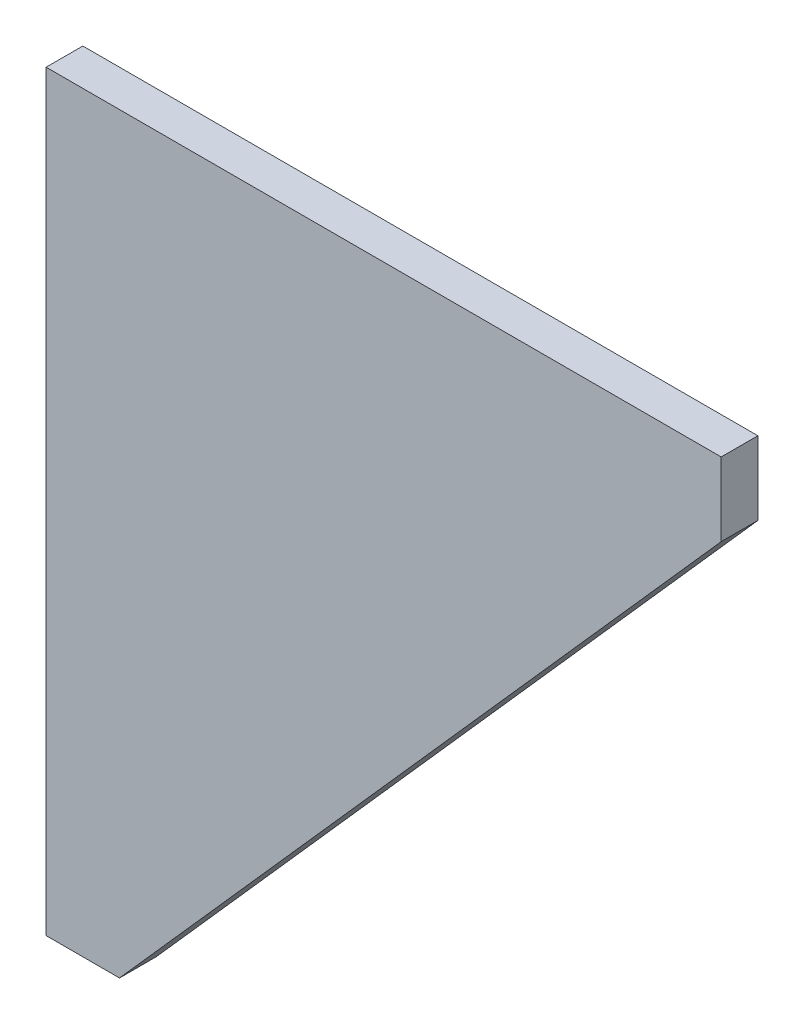
from build123d import *

# Parameters (mm, degrees)
EXTRUDE_1_DEPTH = 2.5


with BuildPart() as part:
    # Sketch 1 → Бобышка-Вытянуть1 (new, symmetric)
    with BuildSketch(Plane.XY):
        Polygon((0, 0), (92, 0), (92, -10), (10, -102.5), (0, -102.5), align=None)
    extrude(amount=EXTRUDE_1_DEPTH, both=True)


solid = part.part
